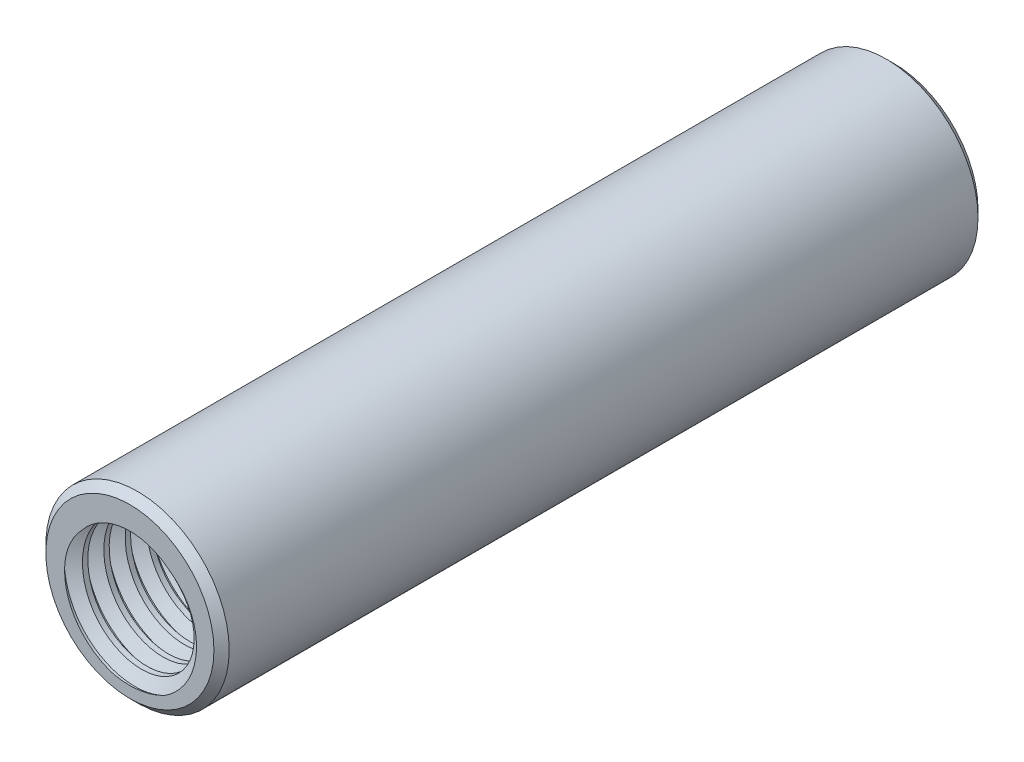
from build123d import *

# Parameters (mm, degrees)
SKETCH1_R           = 3
SKETCH1_R_2         = 2
BOSS_EXTRUDE1_DEPTH = 25
THREAD1_PITCH       = 0.7
CHAMFER1_SIZE       = 0.25


with BuildPart() as part:
    # Sketch1 → Boss-Extrude1 (new body)
    with BuildSketch(Plane.XY):
        Circle(SKETCH1_R)
        Circle(SKETCH1_R_2, mode=Mode.SUBTRACT)
    extrude(amount=BOSS_EXTRUDE1_DEPTH)

    # Thread1: the profile of Thread Profile1 profile screwed along a right-hand helix of 37.142857 turns, 6 arcs to a turn; built about Z, then put on its axis
    thread1_z = Axis((0, 0, 0), (0, 0, 1))
    thread1_corners = [(1.9997, 0, -0.000173205), (2.378886113, 0, 0.218749999), (2.378886113, 0, 0.306249999), (1.9997, 0, 0.525173203)]
    with BuildLine(mode=Mode.PRIVATE) as thread1_profile:
        Line(thread1_corners[0], thread1_corners[1])
        Line(thread1_corners[1], thread1_corners[2])
        Line(thread1_corners[2], thread1_corners[3])
        Line(thread1_corners[3], thread1_corners[0])
    thread1_cap = Face(thread1_profile.wire())
    thread1_turn_angles = [0, 30, 60, 90, 120, 150, 180, 210, 240, 270, 300, 330, 360]
    thread1_turn_weights = [1, 0.8660254037844387, 1, 0.8660254037844387, 1, 0.8660254037844387, 1, 0.8660254037844387, 1, 0.8660254037844387, 1, 0.8660254037844387, 1]
    thread1_turn_rails = [Edge.make_bspline([Vector(p[0], p[1], 0).rotate(thread1_z, thread1_turn_angles[k]) / thread1_turn_weights[k] + Vector(0, 0, p[2] + THREAD1_PITCH * thread1_turn_angles[k] / 360) for k in range(13)], [0, 0, 0, 1, 1, 2, 2, 3, 3, 4, 4, 5, 5, 6, 6, 6], 2, thread1_turn_weights) for p in thread1_corners]
    thread1_turn_sides = [Face.make_surface_from_curves(thread1_turn_rails[p[0]], thread1_turn_rails[p[1]]) for p in [(0, 1), (1, 2), (2, 3), (3, 0)]]
    thread1_last_angles = [13320, 13345.714285714, 13371.428571429]
    thread1_last_weights = [1, 0.9009688679024151, 1]
    thread1_last_rails = [Edge.make_bspline([Vector(p[0], p[1], 0).rotate(thread1_z, thread1_last_angles[k]) / thread1_last_weights[k] + Vector(0, 0, p[2] + THREAD1_PITCH * thread1_last_angles[k] / 360) for k in range(3)], [0, 0, 0, 1, 1, 1], 2, thread1_last_weights) for p in thread1_corners]
    thread1_last_sides = [Face.make_surface_from_curves(thread1_last_rails[p[0]], thread1_last_rails[p[1]]) for p in [(0, 1), (1, 2), (2, 3), (3, 0)]]
    thread1 = Plane(origin=(0, 0, -1), x_dir=(1, 0, 0), z_dir=(0, 0, 1)) * Solid(Shell([*[p.moved(Location((0, 0, THREAD1_PITCH * i))) for i in range(37) for p in thread1_turn_sides], *thread1_last_sides, thread1_cap, thread1_cap.rotate(thread1_z, 13371.428571429).moved(Location((0, 0, THREAD1_PITCH * 13371.428571429 / 360)))]))
    add(thread1, mode=Mode.SUBTRACT)

    # Chamfer1
    chamfer1_edges = [part.edges().sort_by_distance(p)[0] for p in [
        (-3, 0, 0),
        (-3, 0, 25),
    ]]
    chamfer(chamfer1_edges, length=CHAMFER1_SIZE)


solid = part.part
